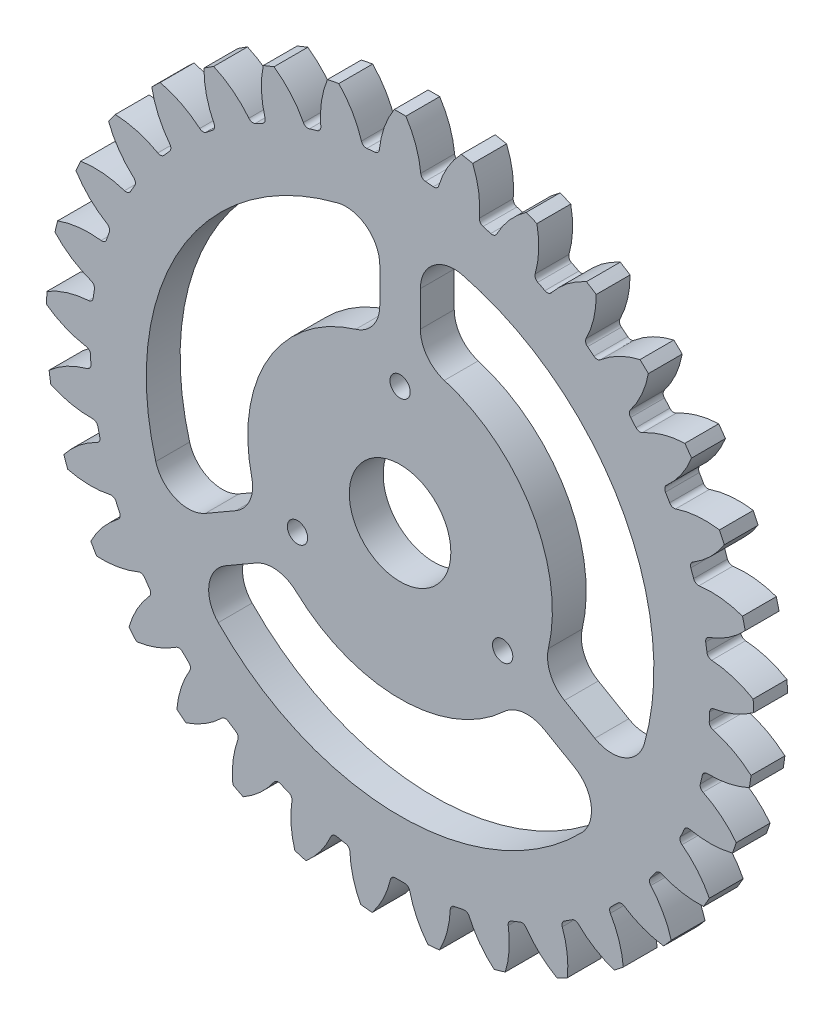
from build123d import *

# Parameters (mm, degrees)
SKETCH_1_R               = 45.75
EXTRUDE_1_DEPTH          = 5
EXTRUDE_2_DEPTH          = 5
FILLET_1_R               = 0.75
PATTERN_CIRCULAR_1_DEPTH = 5
CUT_EXTRUDE_1_REACH      = 76.234
SKETCH_2_R               = 7.5
CUT_EXTRUDE_2_REACH      = 76.234
SKETCH_2_3_R             = 1.5
PATTERN_CIRCULAR_2_COUNT = 3
FILLET_2_R               = 5


# Read off the part's stored shape, not the designer's step: 원형 패턴1
with BuildPart() as part:
    # 스케치1 → 보스-돌출1 (new body)
    with BuildSketch(Plane.XY):
        Circle(SKETCH_1_R)
    extrude(amount=EXTRUDE_1_DEPTH)

    # 스케치1<3> → 보스-돌출2 (add)
    with BuildSketch(Plane.XY):
        with BuildLine():
            ThreePointArc((-3.105, 45.644511992), (0, 45.75), (3.105, 45.644511992))
            ThreePointArc((3.105, 45.644511992), (2.431675794, 49.2171673), (0.855, 52.493037395))
            ThreePointArc((0.855, 52.493037395), (0, 52.5), (-0.855, 52.493037395))
            ThreePointArc((-0.855, 52.493037395), (-2.431675794, 49.2171673), (-3.105, 45.644511992))
        make_face()
    extrude(amount=EXTRUDE_2_DEPTH)

    # 필렛1
    fillet_1_edges = [part.edges().sort_by_distance(p)[0] for p in [
        (-3.105, 45.644511992, 2.5),
        (3.105, 45.644511992, 2.5),
    ]]
    fillet(fillet_1_edges, radius=FILLET_1_R)

    # 원형 패턴1 outline → 원형 패턴1 (add)
    with BuildSketch(Plane.XY):
        with BuildLine():
            ThreePointArc((4.912717758, 45.485466956), (8.615505948, 44.931453985), (12.260594731, 44.076527958))
            ThreePointArc((12.260594731, 44.076527958), (11.844677431, 44.372571726), (11.714599912, 44.866240595))
            ThreePointArc((11.714599912, 44.866240595), (11.614671889, 48.185733646), (10.730200042, 51.386784922))
            ThreePointArc((10.730200042, 51.386784922), (9.891968688, 51.555431517), (9.05110197, 51.71040455))
            ThreePointArc((9.05110197, 51.71040455), (7.038530885, 49.064401078), (5.71179661, 46.016196211))
            ThreePointArc((5.71179661, 46.016196211), (5.408201513, 45.606375472), (4.912717758, 45.485466956))
        make_face()
        with BuildLine():
            ThreePointArc((13.393192853, 43.745684189), (16.924175621, 42.504526577), (20.341889375, 40.978897455))
            ThreePointArc((20.341889375, 40.978897455), (19.989188537, 41.347920963), (19.954355694, 41.857197807))
            ThreePointArc((19.954355694, 41.857197807), (20.480573457, 45.128614732), (20.217582698, 48.431629975))
            ThreePointArc((20.217582698, 48.431629975), (19.426415854, 48.755865233), (18.630073532, 49.067172774))
            ThreePointArc((18.630073532, 49.067172774), (16.15592417, 46.853066978), (14.277421546, 44.115384119))
            ThreePointArc((14.277421546, 44.115384119), (13.902062408, 43.770872586), (13.393192853, 43.745684189))
        make_face()
        with BuildLine():
            ThreePointArc((21.397532013, 40.437706707), (24.629616379, 38.554435503), (27.697040499, 36.413410271))
            ThreePointArc((27.697040499, 36.413410271), (27.420227966, 36.842005988), (27.481651352, 37.348510316))
            ThreePointArc((27.481651352, 37.348510316), (28.609935108, 40.45216191), (28.974249238, 43.734379555))
            ThreePointArc((28.974249238, 43.734379555), (28.258741735, 44.202484769), (27.535705697, 44.658875353))
            ThreePointArc((27.535705697, 44.658875353), (24.693646742, 42.957975342), (22.334669638, 40.63298352))
            ThreePointArc((22.334669638, 40.63298352), (21.901306808, 40.366390845), (21.397532013, 40.437706707))
        make_face()
        with BuildLine():
            ThreePointArc((28.639101588, 35.677224671), (31.456036163, 33.220178941), (34.062986639, 30.541372615))
            ThreePointArc((34.062986639, 30.541372615), (33.871921571, 31.013984946), (34.027104848, 31.499563391))
            ThreePointArc((34.027104848, 31.499563391), (35.710668512, 34.323969478), (36.683710919, 37.46480453))
            ThreePointArc((36.683710919, 37.46480453), (36.069723064, 38.059861158), (35.446125714, 38.644839639))
            ThreePointArc((35.446125714, 38.644839639), (32.343927095, 37.517794742), (29.594900025, 35.691126562))
            ThreePointArc((29.594900025, 35.691126562), (29.119502498, 35.512176526), (28.639101588, 35.677224671))
        make_face()
        with BuildLine():
            ThreePointArc((34.857210282, 29.631695722), (37.157824988, 26.69004575), (39.210856092, 23.570559275))
            ThreePointArc((39.210856092, 23.570559275), (39.112235373, 24.070072245), (39.355313484, 24.517456069))
            ThreePointArc((39.355313484, 24.517456069), (41.527213099, 26.963564833), (43.067327709, 29.849503676))
            ThreePointArc((43.067327709, 29.849503676), (42.577050622, 30.550004822), (42.075430394, 31.242428554))
            ThreePointArc((42.075430394, 31.242428554), (38.830227267, 30.726884404), (35.796709973, 29.463990136))
            ThreePointArc((35.796709973, 29.463990136), (35.296844363, 29.379132084), (34.857210282, 29.631695722))
        make_face()
        with BuildLine():
            ThreePointArc((39.826366972, 22.514950451), (41.528269775, 19.195450228), (42.954075272, 15.748330625))
            ThreePointArc((42.954075272, 15.748330625), (42.95120714, 16.256707716), (43.273204146, 16.650120249))
            ThreePointArc((43.273204146, 16.650120249), (45.849621159, 18.634751437), (47.894379065, 21.163713809))
            ThreePointArc((47.894379065, 21.163713809), (47.545532637, 21.944341536), (47.184019393, 22.719184521))
            ThreePointArc((47.184019393, 22.719184521), (43.917238112, 22.828593345), (40.715224254, 22.172135057))
            ThreePointArc((40.715224254, 22.172135057), (40.209374438, 22.184288942), (39.826366972, 22.514950451))
        make_face()
        with BuildLine():
            ThreePointArc((43.364524628, 14.580140732), (44.407111548, 11.00322425), (45.155187779, 7.35333371))
            ThreePointArc((45.155187779, 7.35333371), (45.247894684, 7.852283733), (45.637084566, 8.177978271))
            ThreePointArc((45.637084566, 8.177978271), (48.521106662, 9.636387647), (50.990402774, 11.721362005))
            ThreePointArc((50.990402774, 11.721362005), (50.795595224, 12.553902392), (50.587254994, 13.383159786))
            ThreePointArc((50.587254994, 13.383159786), (47.419505357, 14.106767088), (44.170313459, 14.075187026))
            ThreePointArc((44.170313459, 14.075187026), (43.677162011, 14.183634619), (43.364524628, 14.580140732))
        make_face()
        with BuildLine():
            ThreePointArc((45.3400033, 6.111186524), (45.686661134, 2.406552392), (45.731126211, -1.313999794))
            ThreePointArc((45.731126211, -1.313999794), (45.915777314, -0.84235686), (46.358129706, -0.595643568))
            ThreePointArc((46.358129706, -0.595643568), (49.443790422, 0.291891285), (52.243500472, 1.863719458))
            ThreePointArc((52.243500472, 1.863719458), (52.209772653, 2.718082327), (52.162135396, 3.571782608))
            ThreePointArc((52.162135396, 3.571782608), (49.208358672, 4.875724971), (46.033435438, 5.463028199))
            ThreePointArc((46.033435438, 5.463028199), (45.571140209, 5.663455006), (45.3400033, 6.111186524))
        make_face()
        with BuildLine():
            ThreePointArc((45.676795237, -2.587059502), (45.316207856, -6.285205288), (44.656704695, -9.941892463))
            ThreePointArc((44.656704695, -9.941892463), (44.926373164, -9.514384481), (45.406064898, -9.35507347))
            ThreePointArc((45.406064898, -9.35507347), (48.58242334, -9.062193227), (51.608381944, -8.052932944))
            ThreePointArc((51.608381944, -8.052932944), (51.736952866, -7.207626493), (51.851740318, -6.360338278))
            ThreePointArc((51.851740318, -6.360338278), (49.216861695, -4.530964842), (46.232807555, -3.354268865))
            ThreePointArc((46.232807555, -3.354268865), (45.818306662, -3.069584709), (45.676795237, -2.587059502))
        make_face()
        with BuildLine():
            ThreePointArc((44.357981929, -11.199640135), (43.304489486, -14.757496073), (41.966139696, -18.21827706))
            ThreePointArc((41.966139696, -18.21827706), (42.310875432, -17.850086096), (42.810848823, -17.783498392))
            ThreePointArc((42.810848823, -17.783498392), (45.965927857, -18.088187851), (49.108002029, -17.670181546))
            ThreePointArc((49.108002029, -17.670181546), (49.394224805, -16.864483091), (49.667288246, -16.054230146))
            ThreePointArc((49.667288246, -16.054230146), (47.442561176, -13.772527918), (44.756647155, -12.057464808))
            ThreePointArc((44.756647155, -12.057464808), (44.405023233, -11.699328297), (44.357981929, -11.199640135))
        make_face()
        with BuildLine():
            ThreePointArc((41.427040609, -19.412954601), (39.720043667, -22.701996192), (37.752461544, -25.84210029))
            ThreePointArc((37.752461544, -25.84210029), (38.159666247, -25.546235792), (38.662215828, -25.574438447))
            ThreePointArc((38.662215828, -25.574438447), (41.686665104, -26.45942502), (44.83273097, -26.640433928))
            ThreePointArc((44.83273097, -26.640433928), (45.266260763, -25.90346351), (45.68773097, -25.159530487))
            ThreePointArc((45.68773097, -25.159530487), (43.947887726, -22.513411659), (41.654267665, -20.329766454))
            ThreePointArc((41.654267665, -20.329766454), (41.378197887, -19.911624465), (41.427040609, -19.412954601))
        make_face()
        with BuildLine():
            ThreePointArc((36.986888608, -26.926428859), (34.689332255, -29.828052697), (32.16474927, -32.53446487))
            ThreePointArc((32.16474927, -32.53446487), (32.619638007, -32.321319656), (33.107008594, -32.443075793))
            ThreePointArc((33.107008594, -32.443075793), (35.897410798, -33.872113409), (38.937088204, -34.639481795))
            ThreePointArc((38.937088204, -34.639481795), (39.502256117, -33.997875445), (40.056900059, -33.347150023))
            ThreePointArc((40.056900059, -33.347150023), (38.858147504, -30.435634424), (37.03489007, -27.868600512))
            ThreePointArc((37.03489007, -27.868600512), (36.844202528, -27.406006992), (36.986888608, -26.926428859))
        make_face()
        with BuildLine():
            ThreePointArc((31.196606799, -33.463924221), (28.392618953, -35.873690763), (25.40320527, -38.049174262))
            ThreePointArc((25.40320527, -38.049174262), (25.889336878, -37.926175625), (26.344317142, -38.13699679))
            ThreePointArc((26.344317142, -38.13699679), (28.806104826, -40.05648948), (31.63415762, -41.378218717))
            ThreePointArc((31.63415762, -41.378218717), (32.310537013, -40.85516576), (32.978308412, -40.32116685))
            ThreePointArc((32.978308412, -40.32116685), (32.357140297, -37.250577334), (31.064122742, -34.397075029))
            ThreePointArc((31.064122742, -34.397075029), (30.965473031, -33.907089125), (31.196606799, -33.463924221))
        make_face()
        with BuildLine():
            ThreePointArc((24.265893369, -38.784390146), (21.057683196, -40.615717136), (17.712180916, -42.182237342))
            ThreePointArc((17.712180916, -42.182237342), (18.212038526, -42.153602036), (18.618535332, -42.445899758))
            ThreePointArc((18.618535332, -42.445899758), (20.668525206, -44.78682872), (23.187886158, -46.613089183))
            ThreePointArc((23.187886158, -46.613089183), (23.951030917, -46.227494116), (24.707794776, -45.829521831))
            ThreePointArc((24.707794776, -45.829521831), (24.680540102, -42.709748627), (23.958172033, -39.674635443))
            ThreePointArc((23.958172033, -39.674635443), (23.954846994, -39.175180134), (24.265893369, -38.784390146))
        make_face()
        with BuildLine():
            ThreePointArc((16.447418161, -42.691274704), (12.951562848, -43.878463052), (9.371364498, -44.779906514))
            ThreePointArc((9.371364498, -44.779906514), (9.866967104, -44.846505026), (10.210546569, -45.209837459))
            ThreePointArc((10.210546569, -45.209837459), (11.779123017, -47.889918532), (13.903544075, -50.154891336))
            ThreePointArc((13.903544075, -50.154891336), (14.72587216, -49.92069057), (15.54427706, -49.673128663))
            ThreePointArc((15.54427706, -49.673128663), (16.107273678, -46.614082188), (15.975963776, -43.506432234))
            ThreePointArc((15.975963776, -43.506432234), (16.06781292, -43.015640183), (16.447418161, -42.691274704))
        make_face()
        with BuildLine():
            ThreePointArc((8.027365424, -45.040247605), (4.370626506, -45.540752343), (0.68544231, -45.744864945))
            ThreePointArc((0.68544231, -45.744864945), (1.158968343, -45.90419747), (1.427349909, -46.325605932))
            ThreePointArc((1.427349909, -46.325605932), (2.460336603, -49.251641912), (4.116691684, -51.875615217))
            ThreePointArc((4.116691684, -51.875615217), (4.968482015, -51.801273378), (5.818948671, -51.713069383))
            ThreePointArc((5.818948671, -51.713069383), (6.949224065, -48.821387172), (7.409471506, -45.750960366))
            ThreePointArc((7.409471506, -45.750960366), (7.592961233, -45.286531425), (8.027365424, -45.040247605))
        make_face()
        with BuildLine():
            ThreePointArc((-0.68544231, -45.744864945), (-4.370626506, -45.540752343), (-8.027365424, -45.040247605))
            ThreePointArc((-8.027365424, -45.040247605), (-7.592961233, -45.286531425), (-7.409471506, -45.750960366))
            ThreePointArc((-7.409471506, -45.750960366), (-6.949224065, -48.821387172), (-5.818948671, -51.713069383))
            ThreePointArc((-5.818948671, -51.713069383), (-4.968482015, -51.801273378), (-4.116691684, -51.875615217))
            ThreePointArc((-4.116691684, -51.875615217), (-2.460336603, -49.251641912), (-1.427349909, -46.325605932))
            ThreePointArc((-1.427349909, -46.325605932), (-1.158968343, -45.90419747), (-0.68544231, -45.744864945))
        make_face()
        with BuildLine():
            ThreePointArc((-9.371364498, -44.779906514), (-12.951562848, -43.878463052), (-16.447418161, -42.691274704))
            ThreePointArc((-16.447418161, -42.691274704), (-16.06781292, -43.015640183), (-15.975963776, -43.506432234))
            ThreePointArc((-15.975963776, -43.506432234), (-16.107273678, -46.614082188), (-15.54427706, -49.673128663))
            ThreePointArc((-15.54427706, -49.673128663), (-14.72587216, -49.92069057), (-13.903544075, -50.154891336))
            ThreePointArc((-13.903544075, -50.154891336), (-11.779123017, -47.889918532), (-10.210546569, -45.209837459))
            ThreePointArc((-10.210546569, -45.209837459), (-9.866967104, -44.846505026), (-9.371364498, -44.779906514))
        make_face()
        with BuildLine():
            ThreePointArc((-17.712180916, -42.182237342), (-21.057683196, -40.615717136), (-24.265893369, -38.784390146))
            ThreePointArc((-24.265893369, -38.784390146), (-23.954846994, -39.175180134), (-23.958172033, -39.674635443))
            ThreePointArc((-23.958172033, -39.674635443), (-24.680540102, -42.709748627), (-24.707794776, -45.829521831))
            ThreePointArc((-24.707794776, -45.829521831), (-23.951030917, -46.227494116), (-23.187886158, -46.613089183))
            ThreePointArc((-23.187886158, -46.613089183), (-20.668525206, -44.78682872), (-18.618535332, -42.445899758))
            ThreePointArc((-18.618535332, -42.445899758), (-18.212038526, -42.153602036), (-17.712180916, -42.182237342))
        make_face()
        with BuildLine():
            ThreePointArc((-25.40320527, -38.049174262), (-28.392618953, -35.873690763), (-31.196606799, -33.463924221))
            ThreePointArc((-31.196606799, -33.463924221), (-30.965473031, -33.907089125), (-31.064122742, -34.397075029))
            ThreePointArc((-31.064122742, -34.397075029), (-32.357140297, -37.250577334), (-32.978308412, -40.32116685))
            ThreePointArc((-32.978308412, -40.32116685), (-32.310537013, -40.85516576), (-31.63415762, -41.378218717))
            ThreePointArc((-31.63415762, -41.378218717), (-28.806104826, -40.05648948), (-26.344317142, -38.13699679))
            ThreePointArc((-26.344317142, -38.13699679), (-25.889336878, -37.926175625), (-25.40320527, -38.049174262))
        make_face()
        with BuildLine():
            ThreePointArc((-32.16474927, -32.53446487), (-34.689332255, -29.828052697), (-36.986888608, -26.926428859))
            ThreePointArc((-36.986888608, -26.926428859), (-36.844202528, -27.406006992), (-37.03489007, -27.868600512))
            ThreePointArc((-37.03489007, -27.868600512), (-38.858147504, -30.435634424), (-40.056900059, -33.347150023))
            ThreePointArc((-40.056900059, -33.347150023), (-39.502256117, -33.997875445), (-38.937088204, -34.639481795))
            ThreePointArc((-38.937088204, -34.639481795), (-35.897410798, -33.872113409), (-33.107008594, -32.443075793))
            ThreePointArc((-33.107008594, -32.443075793), (-32.619638007, -32.321319656), (-32.16474927, -32.53446487))
        make_face()
        with BuildLine():
            ThreePointArc((-37.752461544, -25.84210029), (-39.720043667, -22.701996192), (-41.427040609, -19.412954601))
            ThreePointArc((-41.427040609, -19.412954601), (-41.378197887, -19.911624465), (-41.654267665, -20.329766454))
            ThreePointArc((-41.654267665, -20.329766454), (-43.947887726, -22.513411659), (-45.68773097, -25.159530487))
            ThreePointArc((-45.68773097, -25.159530487), (-45.266260763, -25.90346351), (-44.83273097, -26.640433928))
            ThreePointArc((-44.83273097, -26.640433928), (-41.686665104, -26.45942502), (-38.662215828, -25.574438447))
            ThreePointArc((-38.662215828, -25.574438447), (-38.159666247, -25.546235792), (-37.752461544, -25.84210029))
        make_face()
        with BuildLine():
            ThreePointArc((-41.966139696, -18.21827706), (-43.304489486, -14.757496073), (-44.357981929, -11.199640135))
            ThreePointArc((-44.357981929, -11.199640135), (-44.405023233, -11.699328297), (-44.756647155, -12.057464808))
            ThreePointArc((-44.756647155, -12.057464808), (-47.442561176, -13.772527918), (-49.667288246, -16.054230146))
            ThreePointArc((-49.667288246, -16.054230146), (-49.394224805, -16.864483091), (-49.108002029, -17.670181546))
            ThreePointArc((-49.108002029, -17.670181546), (-45.965927857, -18.088187851), (-42.810848823, -17.783498392))
            ThreePointArc((-42.810848823, -17.783498392), (-42.310875432, -17.850086096), (-41.966139696, -18.21827706))
        make_face()
        with BuildLine():
            ThreePointArc((-44.656704695, -9.941892463), (-45.316207856, -6.285205288), (-45.676795237, -2.587059502))
            ThreePointArc((-45.676795237, -2.587059502), (-45.818306662, -3.069584709), (-46.232807555, -3.354268865))
            ThreePointArc((-46.232807555, -3.354268865), (-49.216861695, -4.530964842), (-51.851740318, -6.360338278))
            ThreePointArc((-51.851740318, -6.360338278), (-51.736952866, -7.207626493), (-51.608381944, -8.052932944))
            ThreePointArc((-51.608381944, -8.052932944), (-48.58242334, -9.062193227), (-45.406064898, -9.35507347))
            ThreePointArc((-45.406064898, -9.35507347), (-44.926373164, -9.514384481), (-44.656704695, -9.941892463))
        make_face()
        with BuildLine():
            ThreePointArc((-45.731126211, -1.313999794), (-45.686661134, 2.406552392), (-45.3400033, 6.111186524))
            ThreePointArc((-45.3400033, 6.111186524), (-45.571140209, 5.663455006), (-46.033435438, 5.463028199))
            ThreePointArc((-46.033435438, 5.463028199), (-49.208358672, 4.875724971), (-52.162135396, 3.571782608))
            ThreePointArc((-52.162135396, 3.571782608), (-52.209772653, 2.718082327), (-52.243500472, 1.863719458))
            ThreePointArc((-52.243500472, 1.863719458), (-49.443790422, 0.291891285), (-46.358129706, -0.595643568))
            ThreePointArc((-46.358129706, -0.595643568), (-45.915777314, -0.84235686), (-45.731126211, -1.313999794))
        make_face()
        with BuildLine():
            ThreePointArc((-45.155187779, 7.35333371), (-44.407111548, 11.00322425), (-43.364524628, 14.580140732))
            ThreePointArc((-43.364524628, 14.580140732), (-43.677162011, 14.183634619), (-44.170313459, 14.075187026))
            ThreePointArc((-44.170313459, 14.075187026), (-47.419505357, 14.106767088), (-50.587254994, 13.383159786))
            ThreePointArc((-50.587254994, 13.383159786), (-50.795595224, 12.553902392), (-50.990402774, 11.721362005))
            ThreePointArc((-50.990402774, 11.721362005), (-48.521106662, 9.636387647), (-45.637084566, 8.177978271))
            ThreePointArc((-45.637084566, 8.177978271), (-45.247894684, 7.852283733), (-45.155187779, 7.35333371))
        make_face()
        with BuildLine():
            ThreePointArc((-42.954075272, 15.748330625), (-41.528269775, 19.195450228), (-39.826366972, 22.514950451))
            ThreePointArc((-39.826366972, 22.514950451), (-40.209374438, 22.184288942), (-40.715224254, 22.172135057))
            ThreePointArc((-40.715224254, 22.172135057), (-43.917238112, 22.828593345), (-47.184019393, 22.719184521))
            ThreePointArc((-47.184019393, 22.719184521), (-47.545532637, 21.944341536), (-47.894379065, 21.163713809))
            ThreePointArc((-47.894379065, 21.163713809), (-45.849621159, 18.634751437), (-43.273204146, 16.650120249))
            ThreePointArc((-43.273204146, 16.650120249), (-42.95120714, 16.256707716), (-42.954075272, 15.748330625))
        make_face()
        with BuildLine():
            ThreePointArc((-39.210856092, 23.570559275), (-37.157824988, 26.69004575), (-34.857210282, 29.631695722))
            ThreePointArc((-34.857210282, 29.631695722), (-35.296844363, 29.379132084), (-35.796709973, 29.463990136))
            ThreePointArc((-35.796709973, 29.463990136), (-38.830227267, 30.726884404), (-42.075430394, 31.242428554))
            ThreePointArc((-42.075430394, 31.242428554), (-42.577050622, 30.550004822), (-43.067327709, 29.849503676))
            ThreePointArc((-43.067327709, 29.849503676), (-41.527213099, 26.963564833), (-39.355313484, 24.517456069))
            ThreePointArc((-39.355313484, 24.517456069), (-39.112235373, 24.070072245), (-39.210856092, 23.570559275))
        make_face()
        with BuildLine():
            ThreePointArc((-34.062986639, 30.541372615), (-31.456036163, 33.220178941), (-28.639101588, 35.677224671))
            ThreePointArc((-28.639101588, 35.677224671), (-29.119502498, 35.512176526), (-29.594900025, 35.691126562))
            ThreePointArc((-29.594900025, 35.691126562), (-32.343927095, 37.517794742), (-35.446125714, 38.644839639))
            ThreePointArc((-35.446125714, 38.644839639), (-36.069723064, 38.059861158), (-36.683710919, 37.46480453))
            ThreePointArc((-36.683710919, 37.46480453), (-35.710668512, 34.323969478), (-34.027104848, 31.499563391))
            ThreePointArc((-34.027104848, 31.499563391), (-33.871921571, 31.013984946), (-34.062986639, 30.541372615))
        make_face()
        with BuildLine():
            ThreePointArc((-27.697040499, 36.413410271), (-24.629616379, 38.554435503), (-21.397532013, 40.437706707))
            ThreePointArc((-21.397532013, 40.437706707), (-21.901306808, 40.366390845), (-22.334669638, 40.63298352))
            ThreePointArc((-22.334669638, 40.63298352), (-24.693646742, 42.957975342), (-27.535705697, 44.658875353))
            ThreePointArc((-27.535705697, 44.658875353), (-28.258741735, 44.202484769), (-28.974249238, 43.734379555))
            ThreePointArc((-28.974249238, 43.734379555), (-28.609935108, 40.45216191), (-27.481651352, 37.348510316))
            ThreePointArc((-27.481651352, 37.348510316), (-27.420227966, 36.842005988), (-27.697040499, 36.413410271))
        make_face()
        with BuildLine():
            ThreePointArc((-20.341889375, 40.978897455), (-16.924175621, 42.504526577), (-13.393192853, 43.745684189))
            ThreePointArc((-13.393192853, 43.745684189), (-13.902062408, 43.770872586), (-14.277421546, 44.115384119))
            ThreePointArc((-14.277421546, 44.115384119), (-16.15592417, 46.853066978), (-18.630073532, 49.067172774))
            ThreePointArc((-18.630073532, 49.067172774), (-19.426415854, 48.755865233), (-20.217582698, 48.431629975))
            ThreePointArc((-20.217582698, 48.431629975), (-20.480573457, 45.128614732), (-19.954355694, 41.857197807))
            ThreePointArc((-19.954355694, 41.857197807), (-19.989188537, 41.347920963), (-20.341889375, 40.978897455))
        make_face()
        with BuildLine():
            ThreePointArc((-5.71179661, 46.016196211), (-7.038530885, 49.064401078), (-9.05110197, 51.71040455))
            ThreePointArc((-9.05110197, 51.71040455), (-9.891968688, 51.555431517), (-10.730200042, 51.386784922))
            ThreePointArc((-10.730200042, 51.386784922), (-11.614671889, 48.185733646), (-11.714599912, 44.866240595))
            ThreePointArc((-11.714599912, 44.866240595), (-11.844677431, 44.372571726), (-12.260594731, 44.076527958))
            ThreePointArc((-12.260594731, 44.076527958), (-8.615505948, 44.931453985), (-4.912717758, 45.485466956))
            ThreePointArc((-4.912717758, 45.485466956), (-5.408201513, 45.606375472), (-5.71179661, 46.016196211))
        make_face()
    extrude(amount=PATTERN_CIRCULAR_1_DEPTH)

    # 스케치2 → 컷-돌출1 (cut, up to next)
    with BuildSketch(Plane.XY.offset(5), mode=Mode.PRIVATE) as cut_extrude_1_sk1:
        with BuildLine():
            ThreePointArc((-3, 37.379807383), (-32.475952642, 18.75), (-33.871862782, -16.09182748))
            Line((-33.871862782, -16.09182748), (-20.811589784, -8.551475349))
            ThreePointArc((-20.811589784, -8.551475349), (-19.485571585, 11.25), (-3, 22.299103121))
            Line((-3, 22.299103121), (-3, 37.379807383))
        make_face()
    cut_extrude_1_tool1 = extrude(cut_extrude_1_sk1.sketch, amount=-CUT_EXTRUDE_1_REACH, mode=Mode.PRIVATE) & part.part
    # 스케치2 → 컷-돌출1 (cut, up to next)
    with BuildSketch(Plane.XY.offset(5), mode=Mode.PRIVATE) as cut_extrude_1_sk2:
        with BuildLine():
            Line((20.811589784, -8.551475349), (33.871862782, -16.09182748))
            ThreePointArc((33.871862782, -16.09182748), (36.581722583, -8.24788293), (37.5, 0))
            ThreePointArc((37.5, 0), (27.556759606, 25.433737437), (3, 37.379807383))
            Line((3, 37.379807383), (3, 22.299103121))
            ThreePointArc((3, 22.299103121), (19.485571585, 11.25), (20.811589784, -8.551475349))
        make_face()
    cut_extrude_1_tool2 = extrude(cut_extrude_1_sk2.sketch, amount=-CUT_EXTRUDE_1_REACH, mode=Mode.PRIVATE) & part.part
    # 스케치2 → 컷-돌출1 (cut, up to next)
    with BuildSketch(Plane.XY.offset(5), mode=Mode.PRIVATE) as cut_extrude_1_sk3:
        with BuildLine():
            ThreePointArc((-30.871862782, -21.287979903), (0, -37.5), (30.871862782, -21.287979903))
            Line((30.871862782, -21.287979903), (17.811589784, -13.747627772))
            ThreePointArc((17.811589784, -13.747627772), (0, -22.5), (-17.811589784, -13.747627772))
            Line((-17.811589784, -13.747627772), (-30.871862782, -21.287979903))
        make_face()
    cut_extrude_1_tool3 = extrude(cut_extrude_1_sk3.sketch, amount=-CUT_EXTRUDE_1_REACH, mode=Mode.PRIVATE) & part.part
    # 스케치2 → 컷-돌출1 (cut, up to next)
    with BuildSketch(Plane.XY.offset(5), mode=Mode.PRIVATE) as cut_extrude_1_sk4:
        Circle(SKETCH_2_R)
    cut_extrude_1_tool4 = extrude(cut_extrude_1_sk4.sketch, amount=-CUT_EXTRUDE_1_REACH, mode=Mode.PRIVATE) & part.part
    add(cut_extrude_1_tool1.solids().sort_by_distance((-22.762916, 13.142176, 5))[0], mode=Mode.SUBTRACT)
    add(cut_extrude_1_tool2.solids().sort_by_distance((22.762916, 13.142176, 5))[0], mode=Mode.SUBTRACT)
    add(cut_extrude_1_tool3.solids().sort_by_distance((0, -26.284351, 5))[0], mode=Mode.SUBTRACT)
    add(cut_extrude_1_tool4.solids().sort_by_distance((0, 0, 5))[0], mode=Mode.SUBTRACT)

    # 스케치2<3> → 컷-돌출2 (cut, up to next)
    with BuildSketch(Plane.XY.offset(5), mode=Mode.PRIVATE) as cut_extrude_2_sk1:
        with Locations((0, 17.5)):
            Circle(SKETCH_2_3_R)
    cut_extrude_2_tool1 = extrude(cut_extrude_2_sk1.sketch, amount=-CUT_EXTRUDE_2_REACH, mode=Mode.PRIVATE) & part.part
    cut_extrude_2 = cut_extrude_2_tool1.solids().sort_by_distance((0, 17.5, 5))[0]
    add(cut_extrude_2, mode=Mode.SUBTRACT)

    # 원형 패턴2: 컷-돌출2 ×3 about axis
    pattern_circular_2_axis = Axis((0, 0, 0), (0, 0, 1))
    for i in range(1, PATTERN_CIRCULAR_2_COUNT):
        add(cut_extrude_2.rotate(pattern_circular_2_axis, i * 360 / PATTERN_CIRCULAR_2_COUNT), mode=Mode.SUBTRACT)

    # 필렛2
    fillet_2_edges = [part.edges().sort_by_distance(p)[0] for p in [
        (-17.811589784, -13.747627772, 2.5),
        (17.811589784, -13.747627772, 2.5),
        (30.871862782, -21.287979903, 2.5),
        (-30.871862782, -21.287979903, 2.5),
        (20.811589784, -8.551475349, 2.5),
        (3, 22.299103121, 2.5),
        (3, 37.379807383, 2.5),
        (33.871862782, -16.09182748, 2.5),
        (-3, 37.379807383, 2.5),
        (-3, 22.299103121, 2.5),
        (-20.811589784, -8.551475349, 2.5),
        (-33.871862782, -16.09182748, 2.5),
    ]]
    fillet(fillet_2_edges, radius=FILLET_2_R)


solid = part.part
